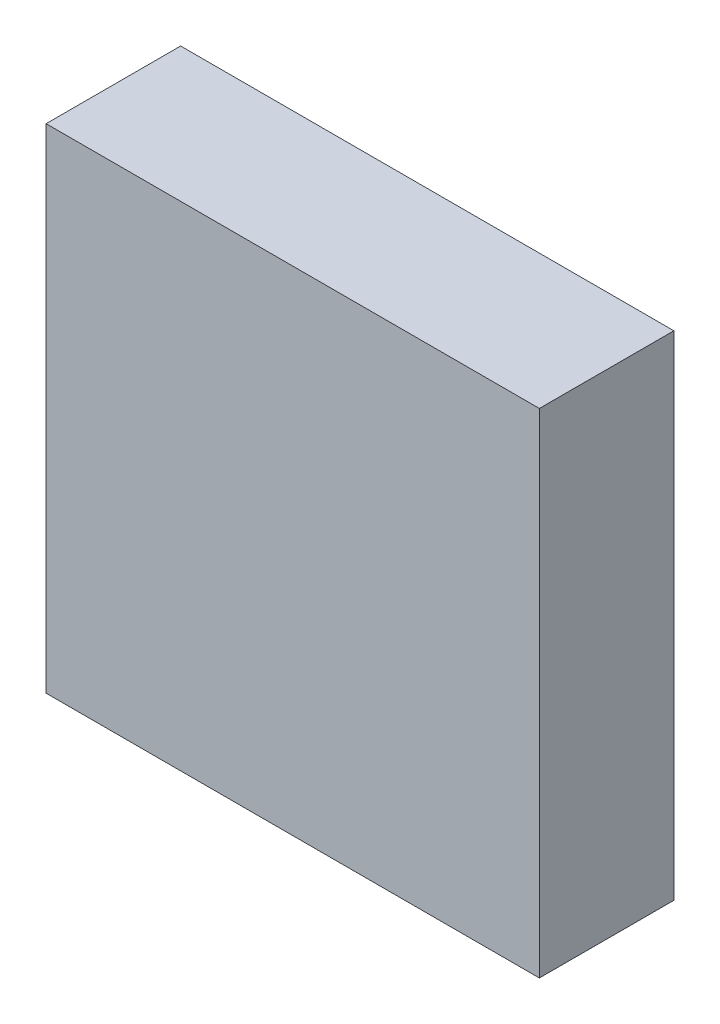
from build123d import *

# Parameters (mm, degrees)
SKETCH1_W           = 220
SKETCH1_H           = 220
BOSS_EXTRUDE1_DEPTH = 60


with BuildPart() as part:
    # Sketch1 → Boss-Extrude1 (new body)
    with BuildSketch(Plane.XY):
        with Locations((110, 110)):
            Rectangle(SKETCH1_W, SKETCH1_H)
    extrude(amount=BOSS_EXTRUDE1_DEPTH)


solid = part.part
